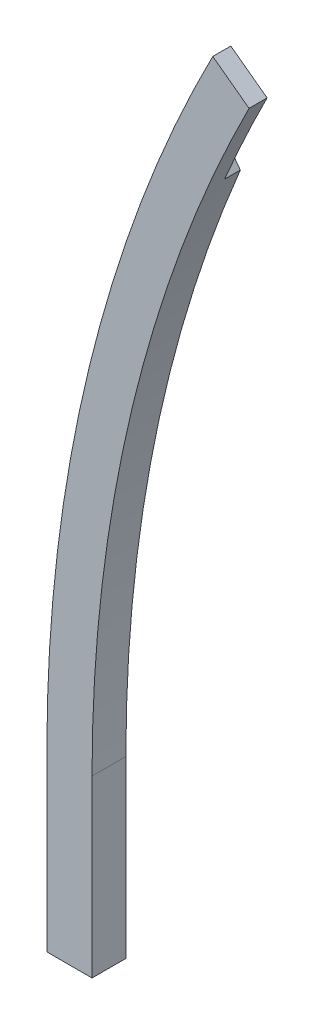
from build123d import *

# Parameters (mm, degrees)
BOSS_EXTRUDE1_DEPTH = 9.525
CUT_EXTRUDE5_DEPTH  = 4.445


with BuildPart() as part:
    # Sketch1 → Boss-Extrude1 (new body)
    with BuildSketch(Plane.XY):
        with BuildLine():
            Line((0, 0), (-12.699993357, 0))
            Line((-12.699993357, 0), (-12.699993357, 49.2125))
            ThreePointArc((-12.699993357, 49.2125), (-0.867671344, 148.164336905), (33.962094137, 241.536481079))
            Line((33.962094137, 241.536481079), (44.182479736, 233.997678159))
            ThreePointArc((44.182479736, 233.997678159), (11.199131028, 144.209412559), (0, 49.2125))
            Line((0, 49.2125), (0, 0))
        make_face()
    extrude(amount=BOSS_EXTRUDE1_DEPTH)

    # Sketch3 → Cut-Extrude5 (cut)
    with BuildSketch(Plane(origin=(0, 0, 0), x_dir=(-1, 0, 0), z_dir=(0, 0, -1))):
        with BuildLine():
            Line((-33.962094137, 241.536481079), (-44.182479736, 233.997678159))
            ThreePointArc((-44.182479736, 233.997678159), (-37.970898934, 221.203555283), (-32.208446684, 208.200960915))
            Line((-32.208446684, 208.200960915), (-23.558344186, 219.854817174))
            ThreePointArc((-23.558344186, 219.854817174), (-28.604884975, 230.770184828), (-33.962094137, 241.536481079))
        make_face()
    extrude(amount=-CUT_EXTRUDE5_DEPTH, mode=Mode.SUBTRACT)


solid = part.part
